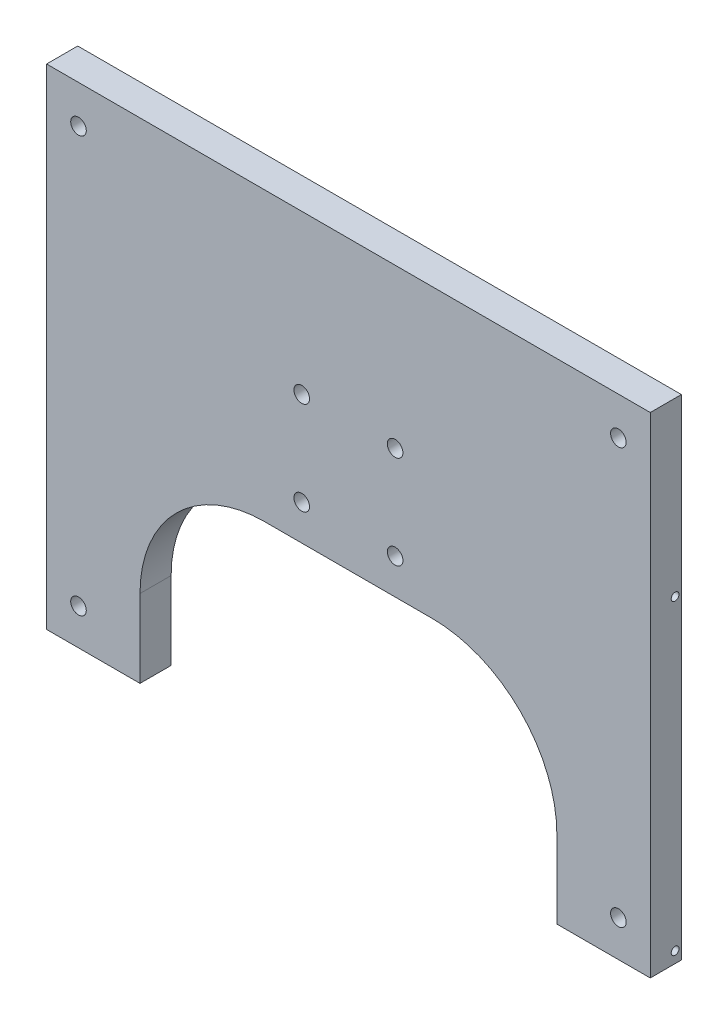
from build123d import *

# Parameters (mm, degrees)
BOSS_EXTRUDE1_DEPTH         = 12.7
F_1_4_0_25_DIAMETER_HOLE1_D = 6.35
FILLET2_R                   = 50.8
HOLE1_AT_2_COUNT            = 2
HOLE1_AT_2_PITCH            = 125.108514383


with BuildPart() as part:
    # Sketch1 → Boss-Extrude1 (new body)
    with BuildSketch(Plane.XY):
        Polygon((258.933482757, 10.713854335), (12.7, 10.713854335), (12.7, -189.051843155), (50.8, -189.051843155), (50.8, -106.501843155), (220.833482757, -106.501843155), (220.833482757, -189.051843155), (258.933482757, -189.051843155), align=None)
    extrude(amount=-BOSS_EXTRUDE1_DEPTH)

    # 1/4 (0.25) Diameter Hole1 (through all)
    with Locations(Plane(origin=(0, 0, -12.7), x_dir=(-1, 0, 0), z_dir=(0, 0, -1))):
        with Locations((-25.706162889, -174.233423282), (-116.766741379, -92.064314729), (-154.866741379, -92.064314729), (-245.927319868, -174.233423282), (-154.866741379, -53.964314729), (-245.927319868, -4.747970506), (-116.766741379, -53.964314729), (-25.706162889, -4.747970506)):
            Hole(F_1_4_0_25_DIAMETER_HOLE1_D / 2)

    # Fillet2
    fillet2_edges = [part.edges().sort_by_distance(p)[0] for p in [
        (220.833482757, -106.501843155, -6.35),
        (50.8, -106.501843155, -6.35),
    ]]
    fillet(fillet2_edges, radius=FILLET2_R)

    # Sketch7 → Hole1 (revolve, cut)
    with BuildSketch(Plane(origin=(0, -184.497964961, -10.137902954), x_dir=(0, 0, 1), z_dir=(0, 1, 0))):
        Polygon((0, 0), (0, 39.053866233), (1.5875, 38.1), (1.5875, 4.017661662), (5.08, 0), align=None)
    hole1 = revolve(axis=Axis((-14.308894879, -184.497964961, -10.137902954), (1, 0, 0)), mode=Mode.SUBTRACT)

    # Hole1 at 2: Hole1 ×2
    with Locations(*[(0, i * HOLE1_AT_2_PITCH, 0) for i in range(1, HOLE1_AT_2_COUNT)]):
        add(hole1, mode=Mode.SUBTRACT)

    # Mirror1: Hole1 across plane
    add(hole1.mirror(Plane.ZY.offset(-135.816741379)), mode=Mode.SUBTRACT)

    # Mirror1 copy 1 sketch → Mirror1 copy 1 (revolve, cut)
    with BuildSketch(Plane(origin=(271.633482757, -59.389450578, -10.137902954), x_dir=(0, 0, 1), z_dir=(0, 1, 0))):
        Polygon((0, 0), (0, -39.053866233), (1.5875, -38.1), (1.5875, -4.017661662), (5.08, 0), align=None)
    revolve(axis=Axis((285.942377636, -59.389450578, -10.137902954), (1, 0, 0)), mode=Mode.SUBTRACT)


solid = part.part
